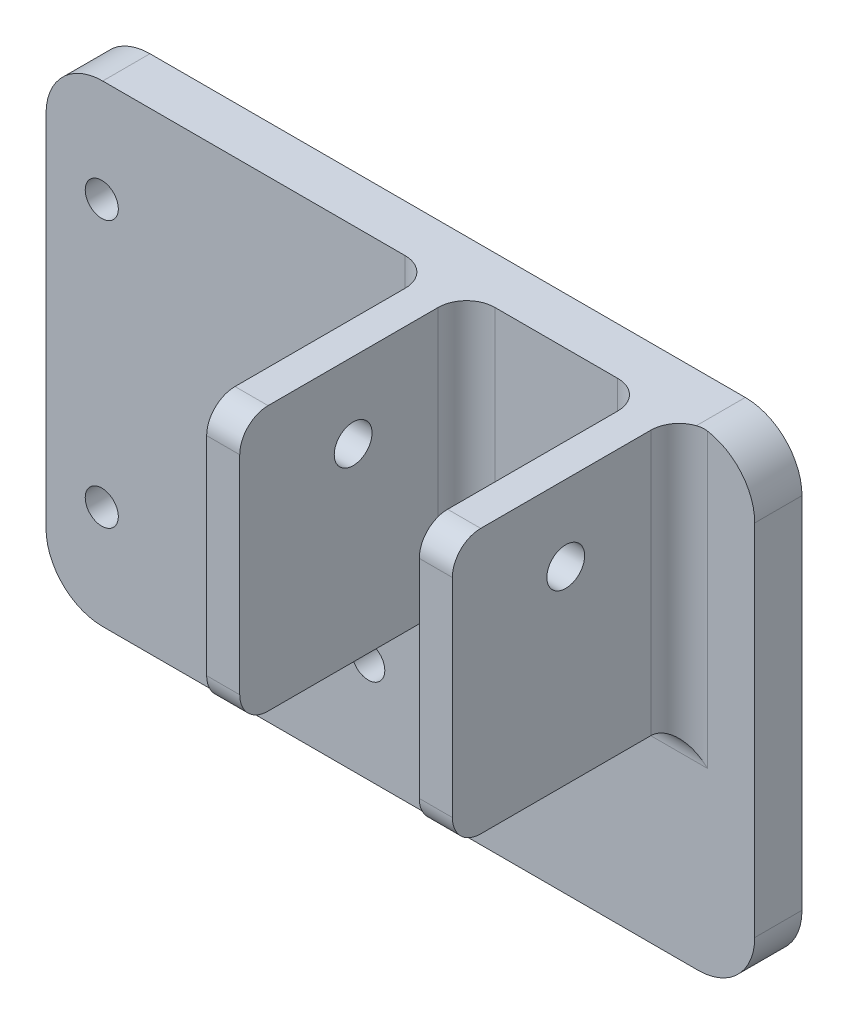
from build123d import *

# Parameters (mm, degrees)
SKETCH1_W               = 3.5
SKETCH1_H               = 28
BOSS_EXTRUDE1_DEPTH     = 24
BOSS_EXTRUDE1_2_DEPTH   = 24
SKETCH2_W               = 75
SKETCH2_H               = 50
BOSS_EXTRUDE2_DEPTH     = 5
FILLET1_R               = 6
FILLET2_R               = 3
CUT_EXTRUDE1_DEPTH      = 80.755877526
CUT_EXTRUDE1_DEPTH_BACK = 80.755877526
SKETCH3_R               = 2
CUT_EXTRUDE2_DEPTH      = 72.08445681
CUT_EXTRUDE2_DEPTH_BACK = 72.08445681
SKETCH4_R               = 1.75


with BuildPart() as part:
    # Sketch1 → Boss-Extrude1 (new body)
    with BuildSketch(Plane.XY):
        with Locations((-11.25, 0)):
            Rectangle(SKETCH1_W, SKETCH1_H)
    extrude(amount=BOSS_EXTRUDE1_DEPTH)



with BuildPart() as body_2:
    # Sketch1 → Boss-Extrude1 2 (new body)
    with BuildSketch(Plane.XY):
        with Locations((11.25, 0)):
            Rectangle(SKETCH1_W, SKETCH1_H)
    extrude(amount=BOSS_EXTRUDE1_2_DEPTH)


with BuildPart() as part_1:
    add(part.part)

    add(body_2.part)  # Boss-Extrude2 merges body 2
    # Sketch2 → Boss-Extrude2 (add)
    with BuildSketch(Plane(origin=(0, 0, 0), x_dir=(-1, 0, 0), z_dir=(0, 0, -1))):
        with Locations((16.5, -11)):
            Rectangle(SKETCH2_W, SKETCH2_H)
    extrude(amount=BOSS_EXTRUDE2_DEPTH)

    # Fillet1
    fillet1_edges = [part_1.edges().sort_by_distance(p)[0] for p in [
        (-54, -36, -2.5),
        (-54, 14, -2.5),
        (21, 14, -2.5),
        (21, -36, -2.5),
    ]]
    fillet(fillet1_edges, radius=FILLET1_R)

    # Fillet2
    fillet2_edges = [part_1.edges().sort_by_distance(p)[0] for p in [
        (11.25, -14, 24),
        (11.25, 14, 24),
        (-11.25, 14, 24),
        (-11.25, -14, 24),
        (-11.25, -14, 0),
        (11.25, -14, 0),
        (-13, 0, 0),
        (13, 0, 0),
        (-9.5, 0, 0),
        (9.5, 0, 0),
    ]]
    fillet(fillet2_edges, radius=FILLET2_R)

    # Sketch3 → Cut-Extrude1 (cut, two sides: drawn at the far end of the back side and taken through both)
    with BuildSketch(Plane(origin=(13, 0, 0), x_dir=(0, 0, -1), z_dir=(1, 0, 0)).offset(-CUT_EXTRUDE1_DEPTH_BACK)):
        with Locations((-12, 6)):
            Circle(SKETCH3_R)
    extrude(amount=CUT_EXTRUDE1_DEPTH + CUT_EXTRUDE1_DEPTH_BACK, mode=Mode.SUBTRACT)

    # Sketch4 → Cut-Extrude2 (cut, two sides: drawn at the far end of the back side and taken through both)
    with BuildSketch(Plane(origin=(0, 0, -5), x_dir=(-1, 0, 0), z_dir=(0, 0, -1)).offset(-CUT_EXTRUDE2_DEPTH_BACK)):
        with Locations((19.9, 3.1)):
            Circle(SKETCH4_R)
        with Locations((48.1, 3.1)):
            Circle(SKETCH4_R)
        with Locations((48.1, -25.1)):
            Circle(SKETCH4_R)
        with Locations((19.9, -25.1)):
            Circle(SKETCH4_R)
    extrude(amount=CUT_EXTRUDE2_DEPTH + CUT_EXTRUDE2_DEPTH_BACK, mode=Mode.SUBTRACT)


solid = part_1.part
